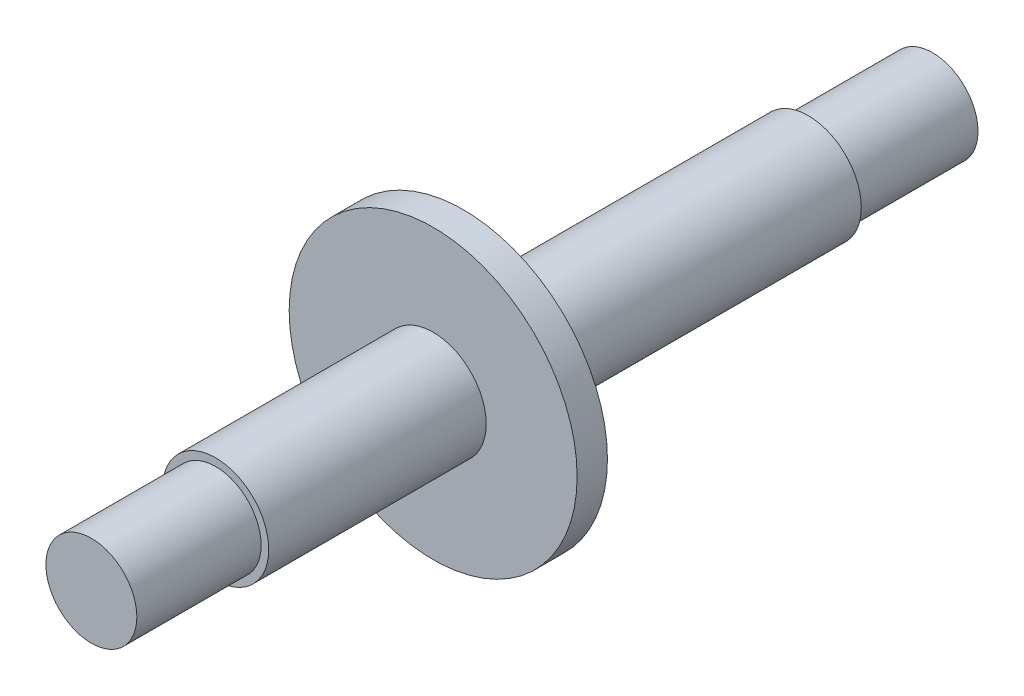
from build123d import *

# Parameters (mm, degrees)
CROQUIS1_R              = 3
SALIENTE_EXTRUIR1_DEPTH = 8.2
CROQUIS2_R              = 3.5
SALIENTE_EXTRUIR2_DEPTH = 22.75
CROQUIS3_R              = 9.5
SALIENTE_EXTRUIR3_DEPTH = 2
CROQUIS4_R              = 3.5
SALIENTE_EXTRUIR4_DEPTH = 14.35
CROQUIS5_R              = 3
SALIENTE_EXTRUIR5_DEPTH = 8.2


with BuildPart() as part:
    # Croquis1 → Saliente-Extruir1 (new body)
    with BuildSketch(Plane.XY):
        Circle(CROQUIS1_R)
    extrude(amount=SALIENTE_EXTRUIR1_DEPTH)

    # Croquis2 → Saliente-Extruir2 (add)
    with BuildSketch(Plane.XY.offset(8.2)):
        Circle(CROQUIS2_R)
    extrude(amount=SALIENTE_EXTRUIR2_DEPTH)

    # Croquis3 → Saliente-Extruir3 (add)
    with BuildSketch(Plane.XY.offset(30.95)):
        Circle(CROQUIS3_R)
    extrude(amount=SALIENTE_EXTRUIR3_DEPTH)

    # Croquis4 → Saliente-Extruir4 (add)
    with BuildSketch(Plane.XY.offset(32.95)):
        Circle(CROQUIS4_R)
    extrude(amount=SALIENTE_EXTRUIR4_DEPTH)

    # Croquis5 → Saliente-Extruir5 (add)
    with BuildSketch(Plane.XY.offset(47.3)):
        Circle(CROQUIS5_R)
    extrude(amount=SALIENTE_EXTRUIR5_DEPTH)


solid = part.part
